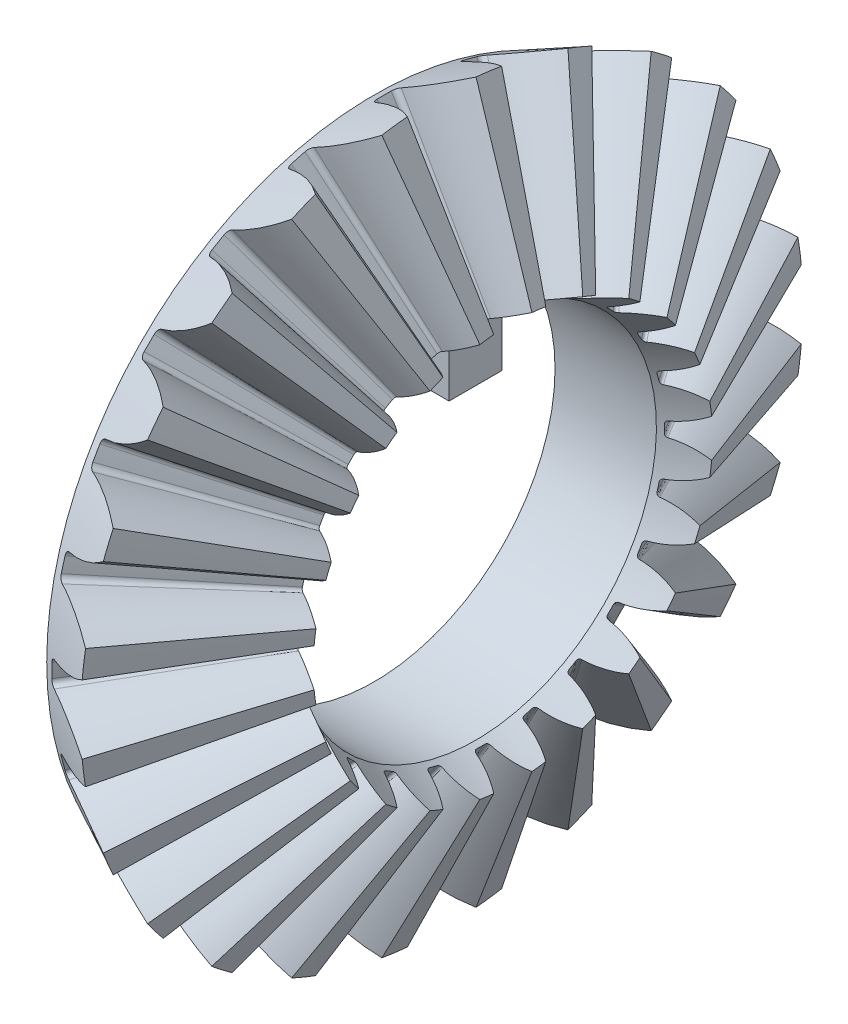
from build123d import *

# Parameters (mm, degrees)
TEETHCUTS_COUNT    = 24
CUT_EXTRUDE1_DEPTH = 9.823374189


with BuildPart() as part:
    # BasProSke → Base-Revolve (revolve)
    with BuildSketch(Plane(origin=(0, 0, 0), x_dir=(1, 0, 0), z_dir=(0, 1, 0)), mode=Mode.PRIVATE) as base_revolve_sk:
        Polygon((0, 0), (0, 5.570954458), (1.151015992, 6.146462452), (2.361656775, 3.397680878), (1.725390784, 3.079547883), (1.725390784, 0), align=None)
    revolve(base_revolve_sk.sketch.rotate(Axis((-10, 0, 0), (1, 0, 0)), 180), axis=Axis((-10, 0, 0), (1, 0, 0)))

    # ToothCut: read off the stored shape, not the designer's step
    # ToothCut: loft between two sections, ruled curve by curve
    toothcut_from = [
        Edge.make_bspline([(3.866679742, 0.004294328, -0.008311653), (3.861216651, 0.001562782, -0.015368109), (3.852893919, -0.002598584, -0.01465016), (3.848463669, -0.004813709, -0.006740268)], [0, 0, 0, 0, 1, 1, 1, 1], 3, [1, 0.729571079, 0.729571079, 1]),
        Edge.make_bspline([(3.848463669, -0.004813709, 0.006740268), (3.852893919, -0.002598584, 0.01465016), (3.861216651, 0.001562782, 0.015368109), (3.866679742, 0.004294328, 0.008311653)], [0, 0, 0, 0, 1, 1, 1, 1], 3, [1, 0.729571079, 0.729571079, 1]),
        Edge.make_bspline([(3.848463669, -0.004813709, -0.006740268), (3.847886666, -0.00510221, -0.005710071), (3.847446944, -0.005322072, -0.004598417), (3.847153487, -0.0054688, -0.003428023)], [0, 0, 0, 0, 1, 1, 1, 1], 3, [1, 0.993188229, 0.993188229, 1]),
        Edge.make_bspline([(3.847153487, -0.0054688, 0.003428023), (3.847446944, -0.005322072, 0.004598417), (3.847886666, -0.00510221, 0.005710071), (3.848463669, -0.004813709, 0.006740268)], [0, 0, 0, 0, 1, 1, 1, 1], 3, [1, 0.993188229, 0.993188229, 1]),
        Edge.make_bspline([(3.847153487, -0.0054688, -0.003428023), (3.846587744, -0.005751672, -0.001171668), (3.846587744, -0.005751672, 0.001171668), (3.847153487, -0.0054688, 0.003428023)], [0, 0, 0, 0, 1, 1, 1, 1], 3, [1, 0.975254599, 0.975254599, 1]),
        Edge.make_line((3.866679742, 0.004294328, 0.008311653), (3.866679742, 0.004294328, -0.008311653)),
    ]
    toothcut_to = [
        Edge.make_bspline([(1.234080279, 6.187994595, -0.658503771), (0.941106992, 6.041507952, -0.419231561), (0.60417878, 5.873043847, -0.268758644), (0.244387298, 5.693148106, -0.2165046)], [0, 0, 0, 0, 1, 1, 1, 1], 3, [1, 0.979133385, 0.979133385, 1]),
        Edge.make_bspline([(0.244387298, 5.693148106, 0.2165046), (0.60417878, 5.873043847, 0.268758644), (0.941106992, 6.041507952, 0.419231561), (1.234080279, 6.187994595, 0.658503771)], [0, 0, 0, 0, 1, 1, 1, 1], 3, [1, 0.979133385, 0.979133385, 1]),
        Edge.make_bspline([(0.244387298, 5.693148106, -0.2165046), (0.199088505, 5.67049871, -0.209925664), (0.169336343, 5.655622629, -0.171172996), (0.170384942, 5.656146929, -0.120115345)], [0, 0, 0, 0, 1, 1, 1, 1], 3, [1, 0.829097797, 0.829097797, 1]),
        Edge.make_bspline([(0.170384942, 5.656146929, 0.120115345), (0.169336343, 5.655622629, 0.171172996), (0.199088505, 5.67049871, 0.209925664), (0.244387298, 5.693148106, 0.2165046)], [0, 0, 0, 0, 1, 1, 1, 1], 3, [1, 0.829097797, 0.829097797, 1]),
        Edge.make_bspline([(0.170384942, 5.656146929, -0.120115345), (0.172029381, 5.656969148, -0.040045483), (0.172029381, 5.656969148, 0.040045483), (0.170384942, 5.656146929, 0.120115345)], [0, 0, 0, 0, 1, 1, 1, 1], 3, [1, 0.999824323, 0.999824323, 1]),
        Edge.make_line((1.234080279, 6.187994595, 0.658503771), (1.234080279, 6.187994595, -0.658503771)),
    ]
    toothcut = Solid(Shell([*[Face.make_surface_from_curves(toothcut_from[k], toothcut_to[k]) for k in range(6)], Face(Wire(toothcut_from)), Face(Wire(toothcut_to))]))
    add(toothcut, mode=Mode.SUBTRACT)

    # TeethCuts: ToothCut ×24 about axis
    teethcuts_axis = Axis((-10, 0, 0), (1, 0, 0))
    for i in range(1, TEETHCUTS_COUNT):
        add(toothcut.rotate(teethcuts_axis, i * 360 / TEETHCUTS_COUNT), mode=Mode.SUBTRACT)

    # Sketch2 → Cut-Extrude1 (cut, through all)
    with BuildSketch(Plane(origin=(1.725390784, 0, 0), x_dir=(0, 0, -1), z_dir=(1, 0, 0))):
        with BuildLine():
            Line((-0.45, 3.046492272), (-0.45, 2.146492272))
            Line((-0.45, 2.146492272), (0.45, 2.146492272))
            Line((0.45, 2.146492272), (0.45, 3.046492272))
            ThreePointArc((0.45, 3.046492272), (0, -3.079547883), (-0.45, 3.046492272))
        make_face()
    extrude(amount=-CUT_EXTRUDE1_DEPTH, mode=Mode.SUBTRACT)


solid = part.part
